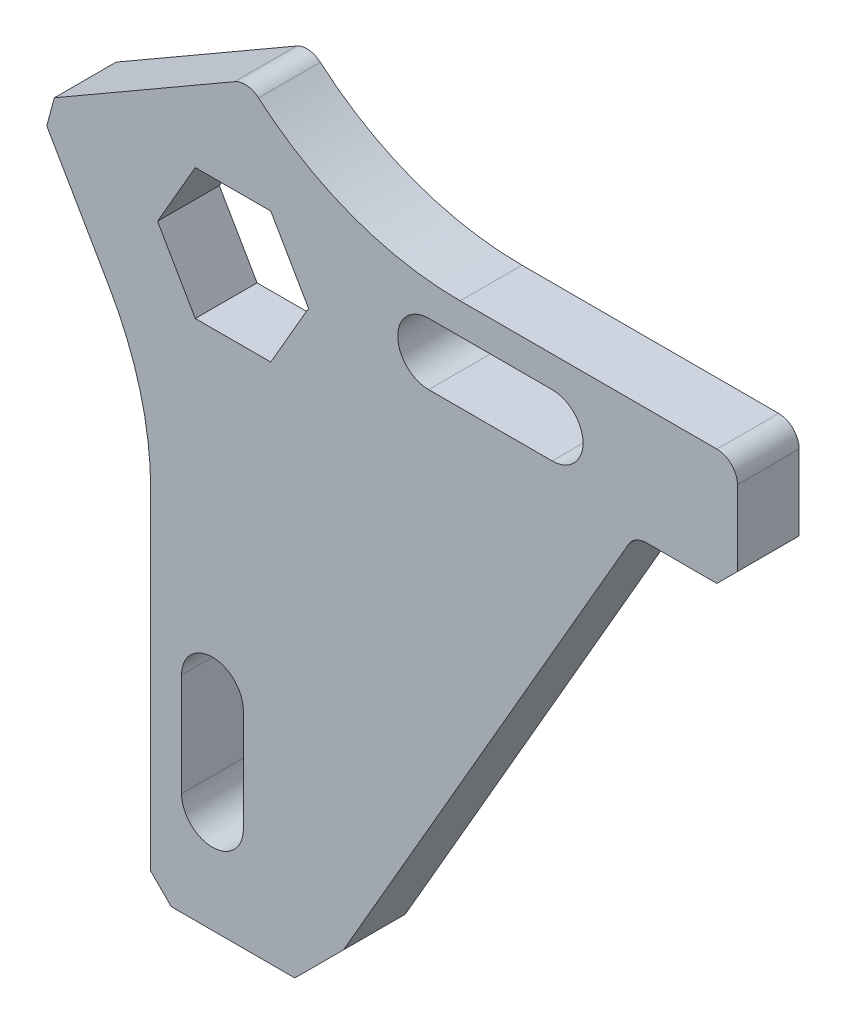
from build123d import *
from OCP.BRepFilletAPI import BRepFilletAPI_MakeChamfer

# Parameters (mm, degrees)
RESSALTO_EXTRUS_O1_DEPTH = 6
RESSALTO_EXTRUS_O2_DEPTH = 6
FILETE1_R                = 30
CHANFRO1_SIZE            = 2
CHANFRO1_SIZE2           = 5.464101615
FILETE2_R                = 2
RESSALTO_EXTRUS_O3_DEPTH = 6
FILETE3_R                = 2
CHANFRO2_SIZE            = 2


with BuildPart() as part:
    # Esboço1 → Ressalto-extrusão1 (new body)
    with BuildSketch(Plane.XY):
        Polygon((0, 0), (0, 65), (47, 65), (47, 53.693575035), (16, 0), align=None)
        Polygon((4.333825791, 50.65), (11.666174209, 50.65), (15.332348419, 57), (11.666174209, 63.35), (4.333825791, 63.35), (0.667651581, 57), align=None, mode=Mode.SUBTRACT)
        with BuildLine():
            Line((9, 20), (9, 10))
            ThreePointArc((9, 10), (6, 7), (3, 10))
            Line((3, 10), (3, 20))
            ThreePointArc((3, 20), (6, 23), (9, 20))
        make_face(mode=Mode.SUBTRACT)
        with BuildLine():
            Line((27, 62), (39, 62))
            ThreePointArc((39, 62), (42, 59), (39, 56))
            Line((39, 56), (27, 56))
            ThreePointArc((27, 56), (24, 59), (27, 62))
        make_face(mode=Mode.SUBTRACT)
    extrude(amount=RESSALTO_EXTRUS_O1_DEPTH)

    # Esboço2 → Ressalto-extrusão2 (add, through all)
    with BuildSketch(Plane.XY.offset(6)):
        Polygon((14.17764788, 65), (9.431163316, 73.221152423), (-11.093638754, 61.371152423), (0, 42.156406461), (0, 65), align=None)
    extrude(amount=-RESSALTO_EXTRUS_O2_DEPTH)

    # Filete1
    # the kernel refuses this fillet: 30 mm, written as the material it adds along each edge
    with BuildSketch(Plane(origin=(0, 42.156406461, 6), x_dir=(0, -1, 0), z_dir=(0, 0, -1))) as filete1_piece_1:
        with BuildLine():
            CenterArc((FILETE1_R * 0.267949192431, FILETE1_R), FILETE1_R, 240, 30)
            Line((-FILETE1_R * 0.232050807569, FILETE1_R * 0.133974596216), (-FILETE1_R * 0.242050807569, FILETE1_R * 0.11665408814))
            Line((-FILETE1_R * 0.242050807569, FILETE1_R * 0.11665408814), (-FILETE1_R * 0.00535898384862, -FILETE1_R * 0.02))
            Line((-FILETE1_R * 0.00535898384862, -FILETE1_R * 0.02), (FILETE1_R * 0.267949192431, -FILETE1_R * 0.02))
            Line((FILETE1_R * 0.267949192431, -FILETE1_R * 0.02), (FILETE1_R * 0.267949192431, 0))
        make_face()
    extrude(amount=6)
    with BuildSketch(Plane(origin=(14.17764788, 65, 6), x_dir=(1, 0, 0), z_dir=(0, 0, -1))) as filete1_piece_2:
        with BuildLine():
            CenterArc((15.885572973, -30), FILETE1_R, 90, 43.451100673)
            Line((-4.746484564, -8.221152423), (-5.159125715, -7.785575471))
            ThreePointArc((-5.159125715, -7.785575471), (-2.892857524, -3.810576211), (-0.519615242, 0.3))
            Line((-0.519615242, 0.3), (0, 0.6))
            Line((0, 0.6), (15.885572973, 0.6))
            Line((15.885572973, 0.6), (15.885572973, 0))
        make_face()
    extrude(amount=6)

    # Chanfro1: one chamfer whose edges measure the first distance from different faces: ONE call of the kernel's chamfer builder (chamfer() names one face for all edges)
    chanfro1_edges_1 = [part.edges().sort_by_distance(p)[0] for p in [
        (-11.093638754, 61.371152423, 3),
        (0, 0, 3),
        (47, 65, 3),
    ]]
    chanfro1_edges_2 = [part.edges().sort_by_distance(p)[0] for p in [
        (16, 0, 3),
    ]]
    chanfro1_side_2 = [part.faces().sort_by_distance(p)[0] for p in [
        (8, 0, 3),
    ]]
    chanfro1 = BRepFilletAPI_MakeChamfer(part.part.solid().wrapped)
    for e in chanfro1_edges_1:
        chanfro1.Add(CHANFRO1_SIZE, e.wrapped)
    for e in chanfro1_edges_2:
        chanfro1.Add(CHANFRO1_SIZE, CHANFRO1_SIZE2, e.wrapped, chanfro1_side_2[0].wrapped)  # the first distance lies on this face
    add(Compound.cast(chanfro1.Shape()), mode=Mode.REPLACE)

    # Filete2
    filete2_edges = [part.edges().sort_by_distance(p)[0] for p in [
        (9.431163316, 73.221152423, 3),
    ]]
    fillet(filete2_edges, radius=FILETE2_R)

    # Esboço3 → Ressalto-extrusão3 (add, through all)
    with BuildSketch(Plane.XY.offset(6)):
        Polygon((45, 65), (57, 65), (57, 53.693575035), (47, 53.693575035), (47, 63), align=None)
    extrude(amount=-RESSALTO_EXTRUS_O3_DEPTH)

    # Filete3
    filete3_edges = [part.edges().sort_by_distance(p)[0] for p in [
        (57, 65, 3),
        (47, 53.693575035, 3),
    ]]
    fillet(filete3_edges, radius=FILETE3_R)

    # Chanfro2
    chanfro2_edges = [part.edges().sort_by_distance(p)[0] for p in [
        (57, 53.693575035, 3),
    ]]
    chamfer(chanfro2_edges, length=CHANFRO2_SIZE)


solid = part.part
